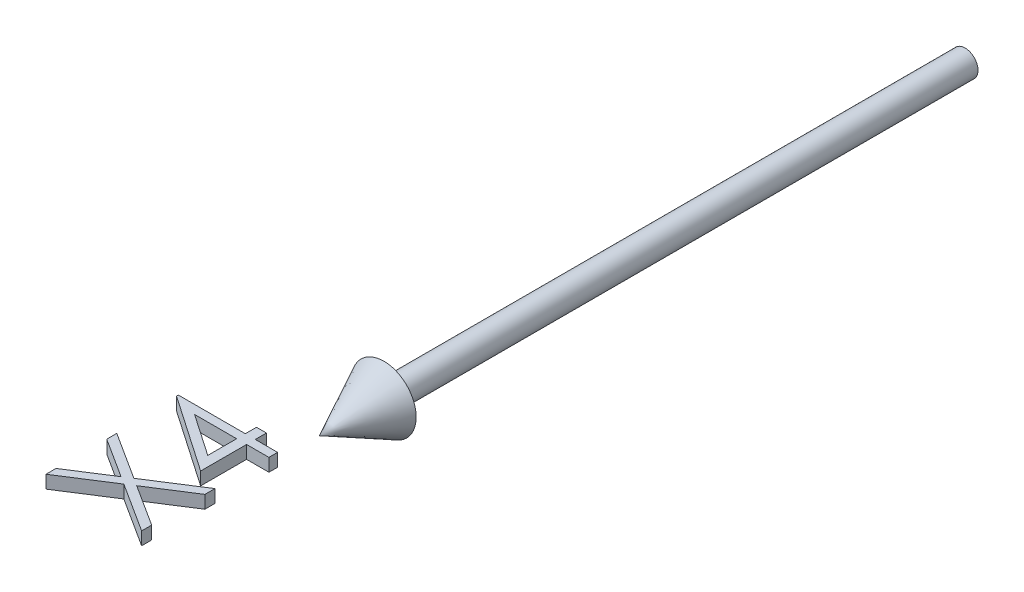
from build123d import *

# Parameters (mm, degrees)
BOSS_EXTRUDE1_DEPTH        = 1
BOSS_EXTRUDE1_DEPTH_BACK   = 1
BOSS_EXTRUDE1_2_DEPTH      = 1
BOSS_EXTRUDE1_2_DEPTH_BACK = 1


with BuildPart() as part:
    # Sketch2 → Revolve1 (revolve)
    with BuildSketch(Plane(origin=(0, 0, 0), x_dir=(1, 0, 0), z_dir=(0, 1, 0))):
        Polygon((0, -100), (5, -90), (2, -90), (2, 0), (0, 0), align=None)
    revolve(axis=Axis((0, 0, -41.949952025), (0, 0, 1)))


with BuildPart() as body_2:
    # Sketch3 → Boss-Extrude1 (new, two sides: drawn at the far end of the back side and taken through both)
    with BuildSketch(Plane(origin=(0, 0, 0), x_dir=(1, 0, 0), z_dir=(0, 1, 0)).offset(-BOSS_EXTRUDE1_DEPTH_BACK)):
        Polygon((-15.384615385, -106.726241459), (-15.384615385, -106.452803959), (-5, -106.452803959), (-5, -104.722034728), (-3.461538462, -104.722034728), (-3.461538462, -106.452803959), (0, -106.452803959), (0, -107.798957805), (-3.461538462, -107.798957805), (-3.461538462, -114.91434242), align=None)
        Polygon((-5, -107.798957805), (-11.514423077, -107.798957805), (-5, -112.270111651), align=None, mode=Mode.SUBTRACT)
    extrude(amount=BOSS_EXTRUDE1_DEPTH + BOSS_EXTRUDE1_DEPTH_BACK)


with BuildPart() as body_3:
    # Sketch3 → Boss-Extrude1 2 (new, two sides: drawn at the far end of the back side and taken through both)
    with BuildSketch(Plane(origin=(0, 0, 0), x_dir=(1, 0, 0), z_dir=(0, 1, 0)).offset(-BOSS_EXTRUDE1_2_DEPTH_BACK)):
        Polygon((-15, -127.318188574), (-15, -125.764702997), (-8.864182692, -121.837419343), (-15, -117.910135689), (-15, -116.356650112), (-7.650240385, -121.059174151), (0, -116.16434242), (0, -117.717827997), (-6.436298077, -121.837419343), (0, -125.957010689), (0, -127.510496266), (-7.650240385, -122.612659728), align=None)
    extrude(amount=BOSS_EXTRUDE1_2_DEPTH + BOSS_EXTRUDE1_2_DEPTH_BACK)


solid = Compound([part.part, body_2.part, body_3.part])
